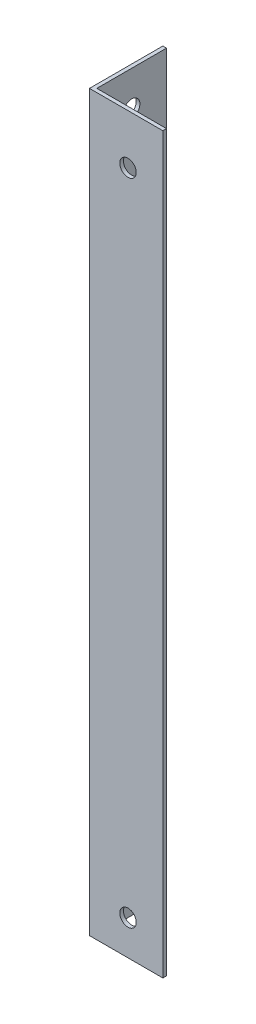
from build123d import *

# Parameters (mm, degrees)
EXTRUDE_1_DEPTH     = 200
SKETCH_2_R          = 2.25
CUT_EXTRUDE_1_DEPTH = 202.893536301
SKETCH_3_R          = 2.25
CUT_EXTRUDE_2_DEPTH = 202.893536301
SKETCH_4_R          = 2.25
CUT_EXTRUDE_3_DEPTH = 202.893536301
SKETCH_5_R          = 2.25
CUT_EXTRUDE_4_DEPTH = 202.893536301


with BuildPart() as part:
    # Эскиз1 → Бобышка-Вытянуть1 (new body)
    with BuildSketch(Plane(origin=(0, 0, 0), x_dir=(1, 0, 0), z_dir=(0, 1, 0))):
        Polygon((0, 0), (0, 20), (1, 20), (1, 1), (20, 1), (20, 0), align=None)
    extrude(amount=EXTRUDE_1_DEPTH)

    # Эскиз2 → Вырез-Вытянуть1 (cut, through all)
    with BuildSketch(Plane(origin=(0, 0, -1), x_dir=(-1, 0, 0), z_dir=(0, 0, -1))):
        with Locations((-10.5, 9.5)):
            Circle(SKETCH_2_R)
    extrude(amount=-CUT_EXTRUDE_1_DEPTH, mode=Mode.SUBTRACT)

    # Эскиз3 → Вырез-Вытянуть2 (cut, through all)
    with BuildSketch(Plane(origin=(0, 0, -1), x_dir=(-1, 0, 0), z_dir=(0, 0, -1))):
        with Locations((-10.5, 186.5)):
            Circle(SKETCH_3_R)
    extrude(amount=-CUT_EXTRUDE_2_DEPTH, mode=Mode.SUBTRACT)

    # Эскиз4 → Вырез-Вытянуть3 (cut, through all)
    with BuildSketch(Plane(origin=(1, 0, 0), x_dir=(0, 0, -1), z_dir=(1, 0, 0))):
        with Locations((10.5, 190.5)):
            Circle(SKETCH_4_R)
    extrude(amount=-CUT_EXTRUDE_3_DEPTH, mode=Mode.SUBTRACT)

    # Эскиз5 → Вырез-Вытянуть4 (cut, through all)
    with BuildSketch(Plane(origin=(1, 0, 0), x_dir=(0, 0, -1), z_dir=(1, 0, 0))):
        with Locations((10.5, 9.5)):
            Circle(SKETCH_5_R)
    extrude(amount=-CUT_EXTRUDE_4_DEPTH, mode=Mode.SUBTRACT)


solid = part.part
